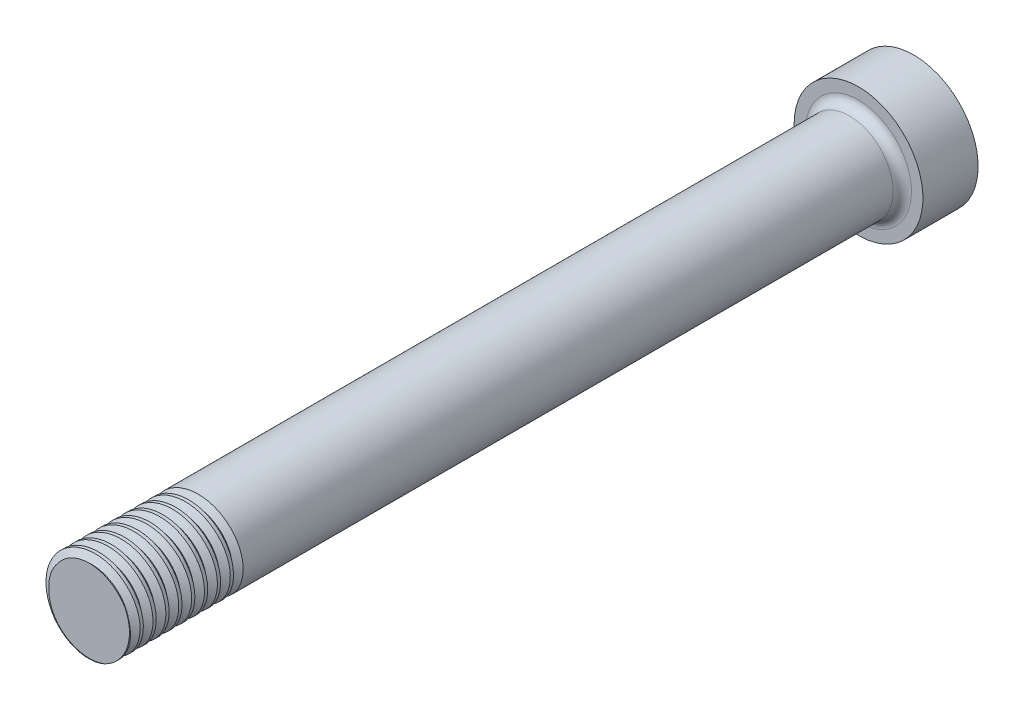
from build123d import *

# Parameters (mm, degrees)
CROQUIS1_R              = 2.38125
SALIENTE_EXTRUIR1_DEPTH = 73
CROQUIS2_R              = 4
SALIENTE_EXTRUIR4_DEPTH = 3
SALIENTE_EXTRUIR4_DRAFT = -28.5
ROSCA1_PITCH            = 0.3175
CORTAR_EXTRUIR2_DEPTH   = 8
CROQUIS11_R             = 4.325240849
CROQUIS11_R_2           = 2.38125
CORTAR_EXTRUIR3_DEPTH   = 8
CROQUIS22_R             = 3.5
CROQUIS22_R_2           = 2.38125
SALIENTE_EXTRUIR8_DEPTH = 3
REDONDEO2_R             = 0.5
CORTAR_EXTRUIR4_START   = -28
CROQUIS23_R             = 2.38125
CORTAR_EXTRUIR4_DEPTH   = 28
ROSCA3_PITCH            = 0.7


with BuildPart() as part:
    # Croquis1 → Saliente-Extruir1 (new body)
    with BuildSketch(Plane.XY):
        Circle(CROQUIS1_R)
    extrude(amount=SALIENTE_EXTRUIR1_DEPTH)


with BuildPart() as saliente_extruir4_tool:
    # Croquis2 → Saliente-Extruir4 (with draft: the straight prism first)
    with BuildSketch(Plane(origin=(0, 0, 0), x_dir=(-1, 0, 0), z_dir=(0, 0, -1))):
        Circle(CROQUIS2_R)
    extrude(amount=-SALIENTE_EXTRUIR4_DEPTH)
    # Saliente-Extruir4: the draft: its side faces are tilted about the plane it starts from
    saliente_extruir4_sides = [saliente_extruir4_tool.faces().sort_by_distance(p)[0] for p in [
        (4, 0, 1.5),
    ]]
    draft(saliente_extruir4_sides, Plane(origin=(0, 0, 0), x_dir=(-1, 0, 0), z_dir=(0, 0, -1)), SALIENTE_EXTRUIR4_DRAFT)


with BuildPart() as part_1:
    add(part.part)

    # Saliente-Extruir4: add saliente_extruir4_tool
    add(saliente_extruir4_tool.part)

    # Rosca1: the profile of Perfil de rosca1 profile screwed along a right-hand helix of 25.19685 turns, 6 arcs to a turn; built about Z, then put on its axis
    rosca1_z = Axis((0, 0, 0), (0, 0, 1))
    rosca1_corners = [(2.38155, 0, -0.000173205), (2.38155, 0, 0.277985704), (2.209398085, 0, 0.17859375), (2.209398085, 0, 0.09921875)]
    with BuildLine(mode=Mode.PRIVATE) as rosca1_profile:
        Line(rosca1_corners[0], rosca1_corners[1])
        Line(rosca1_corners[1], rosca1_corners[2])
        Line(rosca1_corners[2], rosca1_corners[3])
        Line(rosca1_corners[3], rosca1_corners[0])
    rosca1_cap = Face(rosca1_profile.wire())
    rosca1_turn_angles = [0, 30, 60, 90, 120, 150, 180, 210, 240, 270, 300, 330, 360]
    rosca1_turn_weights = [1, 0.8660254037844387, 1, 0.8660254037844387, 1, 0.8660254037844387, 1, 0.8660254037844387, 1, 0.8660254037844387, 1, 0.8660254037844387, 1]
    rosca1_turn_rails = [Edge.make_bspline([Vector(p[0], p[1], 0).rotate(rosca1_z, rosca1_turn_angles[k]) / rosca1_turn_weights[k] + Vector(0, 0, p[2] + ROSCA1_PITCH * rosca1_turn_angles[k] / 360) for k in range(13)], [0, 0, 0, 1, 1, 2, 2, 3, 3, 4, 4, 5, 5, 6, 6, 6], 2, rosca1_turn_weights) for p in rosca1_corners]
    rosca1_turn_sides = [Face.make_surface_from_curves(rosca1_turn_rails[p[0]], rosca1_turn_rails[p[1]]) for p in [(0, 1), (1, 2), (2, 3), (3, 0)]]
    rosca1_last_angles = [9000, 9030, 9060, 9065.433070866, 9070.866141732]
    rosca1_last_weights = [1, 0.8660254037844387, 1, 0.9955074798730315, 1]
    rosca1_last_rails = [Edge.make_bspline([Vector(p[0], p[1], 0).rotate(rosca1_z, rosca1_last_angles[k]) / rosca1_last_weights[k] + Vector(0, 0, p[2] + ROSCA1_PITCH * rosca1_last_angles[k] / 360) for k in range(5)], [0, 0, 0, 1, 1, 2, 2, 2], 2, rosca1_last_weights) for p in rosca1_corners]
    rosca1_last_sides = [Face.make_surface_from_curves(rosca1_last_rails[p[0]], rosca1_last_rails[p[1]]) for p in [(0, 1), (1, 2), (2, 3), (3, 0)]]
    rosca1 = Plane(origin=(0, 0, 75), x_dir=(-1, 0, 0), z_dir=(0, 0, -1)) * Solid(Shell([*[p.moved(Location((0, 0, ROSCA1_PITCH * i))) for i in range(25) for p in rosca1_turn_sides], *rosca1_last_sides, rosca1_cap, rosca1_cap.rotate(rosca1_z, 9070.866141732).moved(Location((0, 0, ROSCA1_PITCH * 9070.866141732 / 360)))]))
    add(rosca1, mode=Mode.SUBTRACT)

    # Croquis10 → Cortar-Extruir2 (cut)
    with BuildSketch(Plane(origin=(0, 0, 0), x_dir=(-1, 0, 0), z_dir=(0, 0, -1))):
        with BuildLine():
            add(Edge.make_bspline(
                [(1.718519161, 0.9921875), (1.79783543, 0.854807692), (0.951795227, 0), (2.220855531, -1.282211538), (0.475897614, -0.824278846), (0, -2.564423077), (-0.475897614, -0.824278846), (-2.220855531, -1.282211538), (-0.951795227, 0), (-2.220855531, 1.282211538), (-0.475897614, 0.824278846), (0, 2.564423077), (0.475897614, 0.824278846), (1.639202892, 1.129567308), (1.718519161, 0.9921875)],
                knots=[0, 0, 0, 0, 0.083333333, 0.166666667, 0.25, 0.333333333, 0.416666667, 0.5, 0.583333333, 0.666666667, 0.75, 0.833333333, 0.916666667, 1, 1, 1, 1], degree=3))
        make_face()
    extrude(amount=-CORTAR_EXTRUIR2_DEPTH, mode=Mode.SUBTRACT)

    # Croquis11 → Cortar-Extruir3 (cut)
    with BuildSketch(Plane(origin=(0, 0, 0), x_dir=(-1, 0, 0), z_dir=(0, 0, -1))):
        Circle(CROQUIS11_R)
        Circle(CROQUIS11_R_2, mode=Mode.SUBTRACT)
    extrude(amount=-CORTAR_EXTRUIR3_DEPTH, mode=Mode.SUBTRACT)

    # Croquis22 → Saliente-Extruir8 (add)
    with BuildSketch(Plane(origin=(0, 0, 0), x_dir=(-1, 0, 0), z_dir=(0, 0, -1))):
        Circle(CROQUIS22_R)
        Circle(CROQUIS22_R_2, mode=Mode.SUBTRACT)
    extrude(amount=-SALIENTE_EXTRUIR8_DEPTH)

    # Redondeo2
    redondeo2_edges = [part_1.edges().sort_by_distance(p)[0] for p in [
        (-2.38125, 0, 3),
    ]]
    fillet(redondeo2_edges, radius=REDONDEO2_R)

    # Croquis23 → Cortar-Extruir4 (cut)
    with BuildSketch(Plane.XY.offset(73).offset(CORTAR_EXTRUIR4_START)):
        with Locations(Location((0, 0, 0), (0, 0, 180))):
            Circle(CROQUIS23_R)
    extrude(amount=CORTAR_EXTRUIR4_DEPTH, mode=Mode.SUBTRACT)

    # Rosca3: the profile of Perfil de rosca4 profile screwed along a right-hand helix of 10 turns, 6 arcs to a turn; built about Z, then put on its axis
    rosca3_z = Axis((0, 0, 0), (0, 0, 1))
    rosca3_corners = [(2.38155, 0, -0.000173205), (2.002363888, 0, 0.218749999), (2.002363888, 0, 0.306249999), (2.38155, 0, 0.525173203)]
    with BuildLine(mode=Mode.PRIVATE) as rosca3_profile:
        Line(rosca3_corners[0], rosca3_corners[1])
        Line(rosca3_corners[1], rosca3_corners[2])
        Line(rosca3_corners[2], rosca3_corners[3])
        Line(rosca3_corners[3], rosca3_corners[0])
    rosca3_cap = Face(rosca3_profile.wire())
    rosca3_turn_angles = [0, 30, 60, 90, 120, 150, 180, 210, 240, 270, 300, 330, 360]
    rosca3_turn_weights = [1, 0.8660254037844387, 1, 0.8660254037844387, 1, 0.8660254037844387, 1, 0.8660254037844387, 1, 0.8660254037844387, 1, 0.8660254037844387, 1]
    rosca3_turn_rails = [Edge.make_bspline([Vector(p[0], p[1], 0).rotate(rosca3_z, rosca3_turn_angles[k]) / rosca3_turn_weights[k] + Vector(0, 0, p[2] + ROSCA3_PITCH * rosca3_turn_angles[k] / 360) for k in range(13)], [0, 0, 0, 1, 1, 2, 2, 3, 3, 4, 4, 5, 5, 6, 6, 6], 2, rosca3_turn_weights) for p in rosca3_corners]
    rosca3_turn_sides = [Face.make_surface_from_curves(rosca3_turn_rails[p[0]], rosca3_turn_rails[p[1]]) for p in [(0, 1), (1, 2), (2, 3), (3, 0)]]
    rosca3 = Plane(origin=(0, 0, 46), x_dir=(-1, 0, 0), z_dir=(0, 0, -1)) * Solid(Shell([*[p.moved(Location((0, 0, ROSCA3_PITCH * i))) for i in range(10) for p in rosca3_turn_sides], rosca3_cap, rosca3_cap.rotate(rosca3_z, 3600).moved(Location((0, 0, ROSCA3_PITCH * 3600 / 360)))]))
    add(rosca3, mode=Mode.SUBTRACT)


solid = part_1.part
